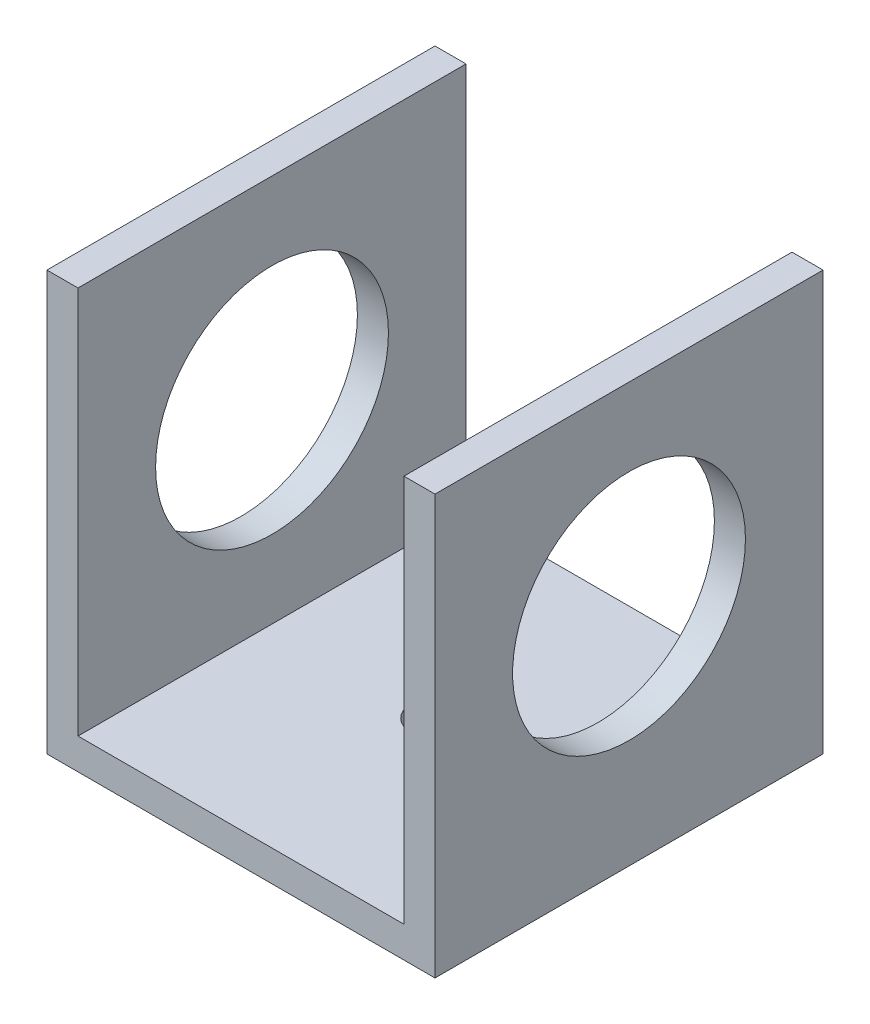
from build123d import *

# Parameters (mm, degrees)
SKETCH1_W           = 50.8
SKETCH1_H           = 50.8
SKETCH1_R           = 3.175
BOSS_EXTRUDE1_DEPTH = 4.064
SKETCH2_W           = 4.064
SKETCH2_H           = 50.8
BOSS_EXTRUDE2_DEPTH = 50.8
SKETCH3_R           = 15.24
CUT_EXTRUDE1_DEPTH  = 79.967452131


with BuildPart() as part:
    # Sketch1 → Boss-Extrude1 (new body)
    with BuildSketch(Plane(origin=(0, 0, 0), x_dir=(1, 0, 0), z_dir=(0, 1, 0))):
        Rectangle(SKETCH1_W, SKETCH1_H)
        Circle(SKETCH1_R, mode=Mode.SUBTRACT)
    extrude(amount=BOSS_EXTRUDE1_DEPTH)

    # Sketch2 → Boss-Extrude2 (add)
    with BuildSketch(Plane(origin=(0, 4.064, 0), x_dir=(1, 0, 0), z_dir=(0, 1, 0))):
        with Locations((-23.368, 0)):
            Rectangle(SKETCH2_W, SKETCH2_H)
        with Locations((23.368, 0)):
            Rectangle(SKETCH2_W, SKETCH2_H)
    extrude(amount=BOSS_EXTRUDE2_DEPTH)

    # Sketch3 → Cut-Extrude1 (cut, through all)
    with BuildSketch(Plane(origin=(25.4, 0, 0), x_dir=(0, 0, -1), z_dir=(1, 0, 0))):
        with Locations((0, 29.464)):
            Circle(SKETCH3_R)
    extrude(amount=-CUT_EXTRUDE1_DEPTH, mode=Mode.SUBTRACT)


solid = part.part
